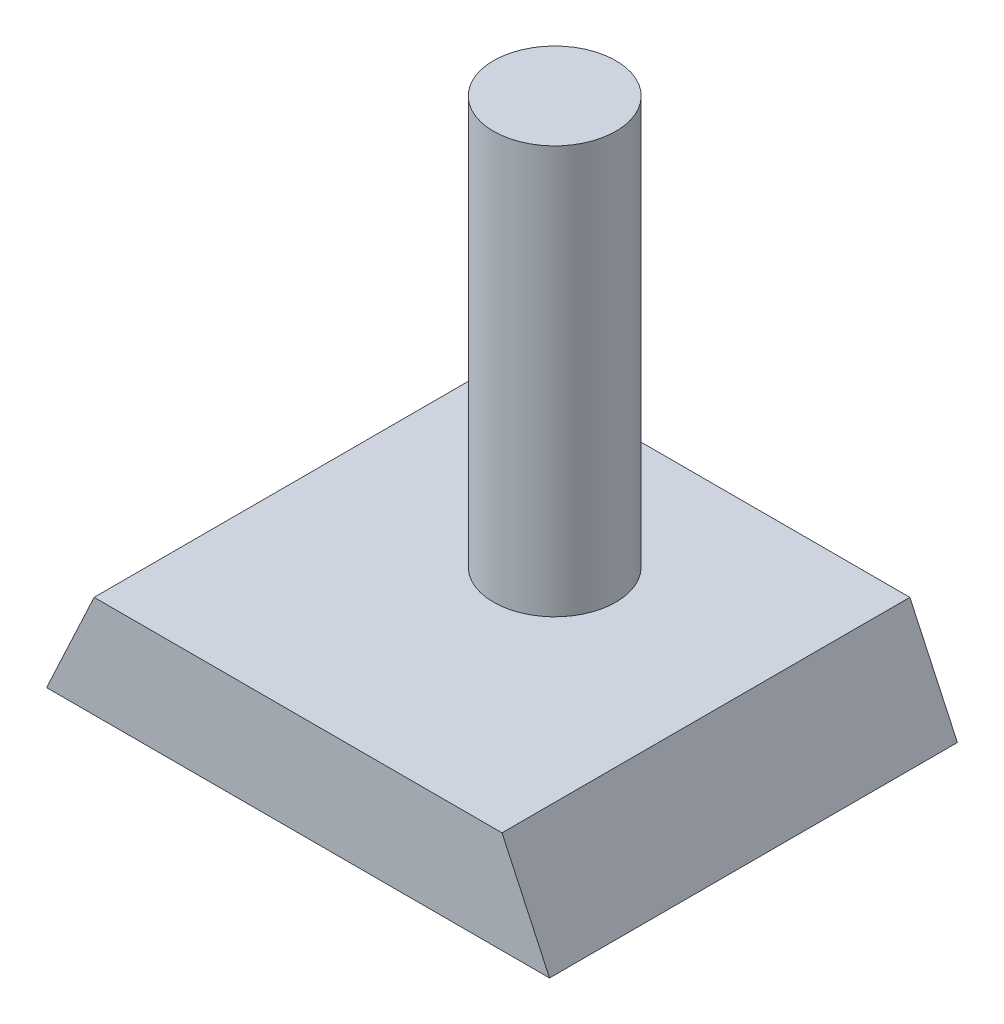
from build123d import *

# Parameters (mm, degrees)
BOSS_EXTRUDE1_DEPTH = 12.7
SKETCH2_R           = 1.905
BOSS_EXTRUDE2_DEPTH = 12.7


with BuildPart() as part:
    # Sketch1 → Boss-Extrude1 (new body)
    with BuildSketch(Plane.XY):
        Polygon((-7.830526815, 0), (7.830526815, 0), (6.35, 3.175), (-6.35, 3.175), align=None)
    extrude(amount=BOSS_EXTRUDE1_DEPTH)

    # Sketch2 → Boss-Extrude2 (add)
    with BuildSketch(Plane(origin=(0, 3.175, 0), x_dir=(1, 0, 0), z_dir=(0, 1, 0))):
        with Locations((0, -4.708818534)):
            Circle(SKETCH2_R)
    extrude(amount=BOSS_EXTRUDE2_DEPTH)


solid = part.part
